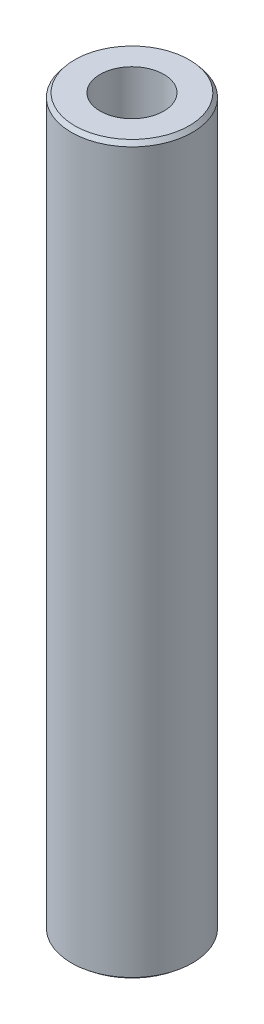
from build123d import *
from OCP.BRepFilletAPI import BRepFilletAPI_MakeChamfer

# Parameters (mm, degrees)
SKETCH1_R           = 50
BOSS_EXTRUDE1_DEPTH = 600
SKETCH2_R           = 26.307126883
CUT_EXTRUDE1_DEPTH  = 605.15229868
CHAMFER1_SIZE       = 3.3781043
CHAMFER1_SIZE2      = 2.754213781


with BuildPart() as part:
    # Sketch1 → Boss-Extrude1 (new body)
    with BuildSketch(Plane(origin=(0, 0, 0), x_dir=(1, 0, 0), z_dir=(0, 1, 0))):
        Circle(SKETCH1_R)
    extrude(amount=BOSS_EXTRUDE1_DEPTH)

    # Sketch2 → Cut-Extrude1 (cut, through all)
    with BuildSketch(Plane(origin=(0, 0, 0), x_dir=(1, 0, 0), z_dir=(0, 1, 0))):
        Circle(SKETCH2_R)
    extrude(amount=CUT_EXTRUDE1_DEPTH, mode=Mode.SUBTRACT)

    # Chamfer1: one chamfer whose edges measure the first distance from different faces: ONE call of the kernel's chamfer builder (chamfer() names one face for all edges)
    chamfer1_edges_1 = [part.edges().sort_by_distance(p)[0] for p in [
        (-50, 600, 0),
    ]]
    chamfer1_side_1 = [part.faces().sort_by_distance(p)[0] for p in [
        (-50, 300, 0),
    ]]
    chamfer1_edges_2 = [part.edges().sort_by_distance(p)[0] for p in [
        (-50, 0, 0),
    ]]
    chamfer1_side_2 = [part.faces().sort_by_distance(p)[0] for p in [
        (-48.585786438, 0, 0),
    ]]
    chamfer1 = BRepFilletAPI_MakeChamfer(part.part.solid().wrapped)
    for e in chamfer1_edges_1:
        chamfer1.Add(CHAMFER1_SIZE, CHAMFER1_SIZE2, e.wrapped, chamfer1_side_1[0].wrapped)  # the first distance lies on this face
    for e in chamfer1_edges_2:
        chamfer1.Add(CHAMFER1_SIZE, CHAMFER1_SIZE2, e.wrapped, chamfer1_side_2[0].wrapped)  # the first distance lies on this face
    add(Compound.cast(chamfer1.Shape()), mode=Mode.REPLACE)


solid = part.part
